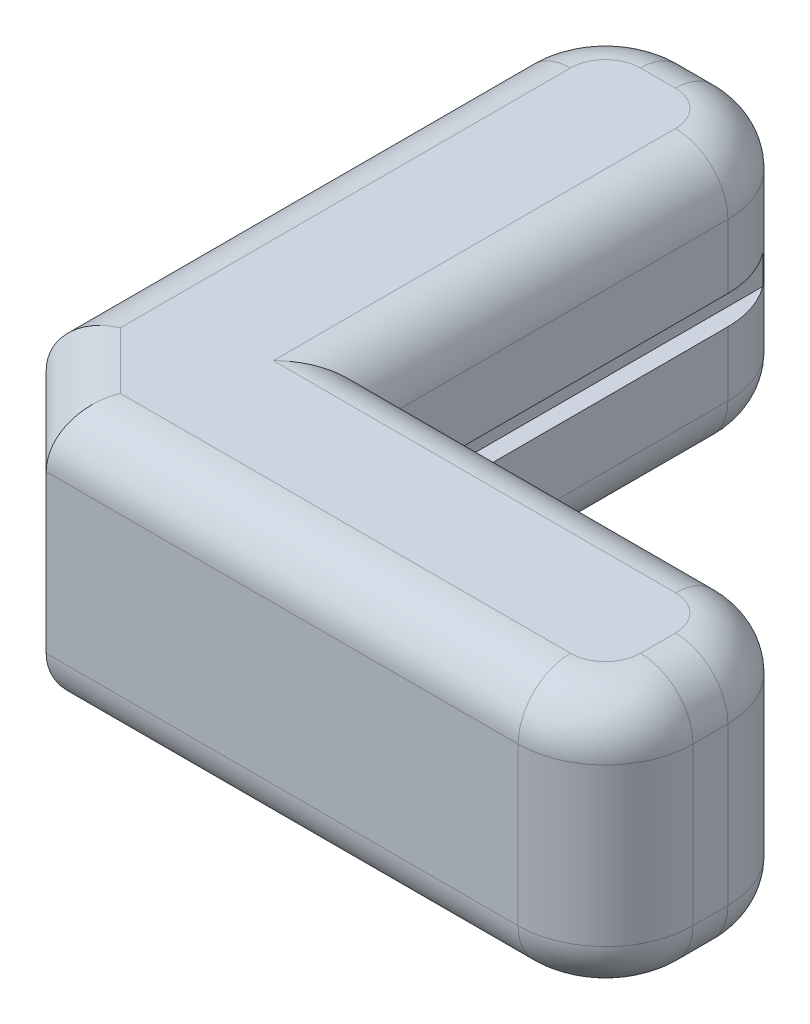
from build123d import *

# Parameters (mm, degrees)
BOSS_EXTRUDE1_DEPTH = 7.5
SKETCH3_W           = 25
SKETCH3_H           = 1.65
CUT_EXTRUDE1_DEPTH  = 1
SKETCH4_W           = 1
SKETCH4_H           = 1.65
CUT_EXTRUDE2_DEPTH  = 26
FILLET1_R           = 5
FILLET2_R           = 3
SKETCH5_R           = 2
CUT_EXTRUDE3_DEPTH  = 7
CUT_SWEEP1_PITCH    = 5


with BuildPart() as part:
    # Sketch1 → Boss-Extrude1 (new, symmetric)
    with BuildSketch(Plane(origin=(0, 0, 0), x_dir=(1, 0, 0), z_dir=(0, 1, 0))):
        Polygon((0, 25), (0, 0), (25, 0), (25, -12), (-7, -12), (-12, -7), (-12, 25), align=None)
    extrude(amount=BOSS_EXTRUDE1_DEPTH, both=True)

    # Sketch3 → Cut-Extrude1 (cut)
    with BuildSketch(Plane(origin=(0, 0, 0), x_dir=(-1, 0, 0), z_dir=(0, 0, -1))):
        with Locations((-12.5, 0)):
            Rectangle(SKETCH3_W, SKETCH3_H)
    extrude(amount=-CUT_EXTRUDE1_DEPTH, mode=Mode.SUBTRACT)

    # Sketch4 → Cut-Extrude2 (cut)
    with BuildSketch(Plane(origin=(0, 0, -25), x_dir=(-1, 0, 0), z_dir=(0, 0, -1))):
        with Locations((0.5, 0)):
            Rectangle(SKETCH4_W, SKETCH4_H)
    extrude(amount=-CUT_EXTRUDE2_DEPTH, mode=Mode.SUBTRACT)

    # Fillet1
    fillet1_edges = [part.edges().sort_by_distance(p)[0] for p in [
        (25, -4.1625, 0),
        (25, 0, 12),
        (0, 4.1625, -25),
        (-12, 0, -25),
    ]]
    fillet(fillet1_edges, radius=FILLET1_R - 0.0001)  # a hair under: the kernel refuses the full size

    # Fillet2
    fillet2_edges = [part.edges().sort_by_distance(p)[0] for p in [
        (-9.5, 7.5, 9.5),
        (6.50005, 7.5, 12),
        (0, 7.5, -10.00005),
        (10.00005, -7.5, 0),
        (-6, -7.5, -25),
        (25, -7.5, 6),
        (-12, -7.5, -6.50005),
        (-10.535563195, -7.5, -23.535563195),
        (-1.464436908, -7.5, -23.535563298),
        (23.535563195, -7.5, 10.535563195),
        (23.535563195, -7.5, 1.464436805),
        (25, 7.5, 6),
        (-6, 7.5, -25),
        (-12, 7.5, -6.50005),
        (10.00005, 7.5, 0),
        (-10.535563195, 7.5, -23.535563195),
        (-1.464436805, 7.5, -23.535563195),
        (23.535563195, 7.5, 10.535563195),
        (23.535563195, 7.5, 1.464436805),
        (0, -7.5, -10.000050146),
        (6.50005, -7.5, 12),
        (-9.5, -7.5, 9.5),
    ]]
    fillet(fillet2_edges, radius=FILLET2_R)

    # Sketch5 → Cut-Extrude3 (cut)
    with BuildSketch(Plane(origin=(-9.5, 0, 9.5), x_dir=(0.7071067811865475, 0, 0.7071067811865477), z_dir=(-0.7071067811865477, 0, 0.7071067811865475))):
        Circle(SKETCH5_R)
    extrude(amount=-CUT_EXTRUDE3_DEPTH, mode=Mode.SUBTRACT)

    # Cut-Sweep1: arcs per turn and ends read off the stored shape
    # Cut-Sweep1: the profile of Sketch8 screwed along a right-hand helix through 2.25 turns, 12 arcs to a turn; built about Z, then put on its axis
    cut_sweep1_z = Axis((0, 0, 0), (0, 0, 1))
    cut_sweep1_corners = [(2, 0, -4.25), (3.5, 0, -5), (2, 0, -5.75), (2, 0, -5)]
    with BuildLine(mode=Mode.PRIVATE) as cut_sweep1_profile:
        Line(cut_sweep1_corners[0], cut_sweep1_corners[1])
        Line(cut_sweep1_corners[1], cut_sweep1_corners[2])
        Line(cut_sweep1_corners[2], cut_sweep1_corners[3])
        Line(cut_sweep1_corners[3], cut_sweep1_corners[0])
    cut_sweep1_cap = Face(cut_sweep1_profile.wire())
    cut_sweep1_turn_angles = [0, 15, 30, 45, 60, 75, 90, 105, 120, 135, 150, 165, 180, 195, 210, 225, 240, 255, 270, 285, 300, 315, 330, 345, 360]
    cut_sweep1_turn_weights = [1, 0.9659258262890683, 1, 0.9659258262890683, 1, 0.9659258262890683, 1, 0.9659258262890683, 1, 0.9659258262890683, 1, 0.9659258262890683, 1, 0.9659258262890683, 1, 0.9659258262890683, 1, 0.9659258262890683, 1, 0.9659258262890683, 1, 0.9659258262890683, 1, 0.9659258262890683, 1]
    cut_sweep1_turn_rails = [Edge.make_bspline([Vector(p[0], p[1], 0).rotate(cut_sweep1_z, cut_sweep1_turn_angles[k]) / cut_sweep1_turn_weights[k] + Vector(0, 0, p[2] + CUT_SWEEP1_PITCH * cut_sweep1_turn_angles[k] / 360) for k in range(25)], [0, 0, 0, 1, 1, 2, 2, 3, 3, 4, 4, 5, 5, 6, 6, 7, 7, 8, 8, 9, 9, 10, 10, 11, 11, 12, 12, 12], 2, cut_sweep1_turn_weights) for p in cut_sweep1_corners]
    cut_sweep1_turn_sides = [Face.make_surface_from_curves(cut_sweep1_turn_rails[p[0]], cut_sweep1_turn_rails[p[1]]) for p in [(0, 1), (1, 2), (2, 3), (3, 0)]]
    cut_sweep1_last_angles = [720, 735, 750, 765, 780, 795, 810]
    cut_sweep1_last_weights = [1, 0.9659258262890683, 1, 0.9659258262890683, 1, 0.9659258262890683, 1]
    cut_sweep1_last_rails = [Edge.make_bspline([Vector(p[0], p[1], 0).rotate(cut_sweep1_z, cut_sweep1_last_angles[k]) / cut_sweep1_last_weights[k] + Vector(0, 0, p[2] + CUT_SWEEP1_PITCH * cut_sweep1_last_angles[k] / 360) for k in range(7)], [0, 0, 0, 1, 1, 2, 2, 3, 3, 3], 2, cut_sweep1_last_weights) for p in cut_sweep1_corners]
    cut_sweep1_last_sides = [Face.make_surface_from_curves(cut_sweep1_last_rails[p[0]], cut_sweep1_last_rails[p[1]]) for p in [(0, 1), (1, 2), (2, 3), (3, 0)]]
    cut_sweep1 = Plane(origin=(-9.5, 0, 9.5), x_dir=(0.7071067811865475, 0, 0.7071067811865477), z_dir=(0.7071067811865477, 0, -0.7071067811865475)) * Solid(Shell([*[p.moved(Location((0, 0, CUT_SWEEP1_PITCH * i))) for i in range(2) for p in cut_sweep1_turn_sides], *cut_sweep1_last_sides, cut_sweep1_cap, cut_sweep1_cap.rotate(cut_sweep1_z, 810).moved(Location((0, 0, CUT_SWEEP1_PITCH * 810 / 360)))]))
    add(cut_sweep1, mode=Mode.SUBTRACT)


solid = part.part
